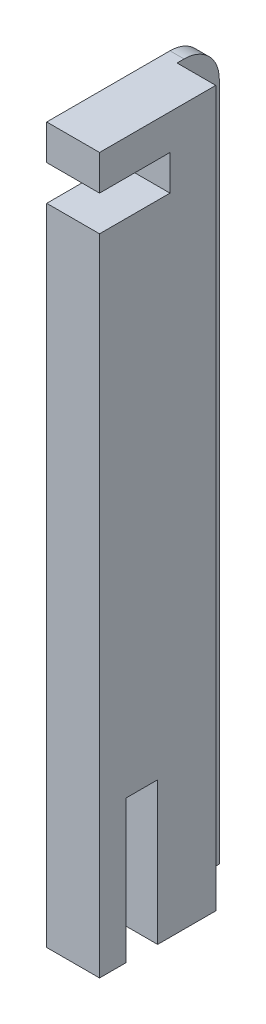
from build123d import *

# Parameters (mm, degrees)
EXTRUDE_1_DEPTH        = 26
EXTRUDE_2_DEPTH        = 19
FILLET_1_R             = 10
SKETCH_5_W             = 161
SKETCH_5_H             = 6
CUT_EXTRUDE_1_DEPTH    = 52
SKETCH_1_5_W           = 11
SKETCH_1_5_H           = 340
EXTRUDE_4_DEPTH        = 7
SKETCH_6_W             = 1.9
SKETCH_6_H             = 2
SKETCH_6_W_2           = 6.6
EXTRUDE_5_DEPTH        = 28
SKETCH_6_3_W           = 6.6
SKETCH_6_3_H           = 2
CUT_EXTRUDE_2_DEPTH    = 5
FILLET_2_R             = 20
SKETCH_6_4_W           = 15
SKETCH_6_4_H           = 10
SKETCH_6_4_H_2         = 9
EXTRUDE_6_DEPTH        = 30
SKETCH_6_5_W           = 15
SKETCH_6_5_H           = 9
EXTRUDE_7_DEPTH        = 28
EXTRUDE_8_DEPTH        = 15
FILLET_3_R             = 20
FILLET_3_OF_MIRROR_2_R = 20
FILLET_4_R             = 20
SKETCH_11_W            = 20
SKETCH_11_H            = 20
CUT_EXTRUDE_3_DEPTH    = 617
SKETCH_10_W            = 20
SKETCH_10_H            = 10
CUT_EXTRUDE_4_DEPTH    = 617
CUT_EXTRUDE_START      = -37
SKETCH_12_W            = 8
SKETCH_12_H            = 20
SKETCH_12_W_2          = 0.5
CUT_EXTRUDE_5_DEPTH    = 37


with BuildPart() as part:
    # 스케치1 → 보스-돌출1 (new body)
    with BuildSketch(Plane.XY):
        Polygon((-168, 0), (168, 0), (183, 0), (183, -340), (168, -340), (168, -20), (-168, -20), (-168, -340), (-183, -340), (-183, 0), align=None)
    extrude(amount=EXTRUDE_1_DEPTH)

    # 스케치1<4> → 보스-돌출2 (add)
    with BuildSketch(Plane.XY):
        Polygon((172, 0), (168, 0), (168, -20), (168, -340), (172, -340), align=None)
        Polygon((-168, -20), (-168, 0), (-172, 0), (-172, -340), (-168, -340), align=None)
    extrude(amount=-EXTRUDE_2_DEPTH)

    # 필렛1
    fillet_1_edges = [part.edges().sort_by_distance(p)[0] for p in [
        (170, 0, -19),
        (170, -340, -19),
        (-170, -340, -19),
        (-170, 0, -19),
    ]]
    fillet(fillet_1_edges, radius=FILLET_1_R)

    # 스케치5 → 컷-돌출1 (cut)
    with BuildSketch(Plane(origin=(0, 0, 0), x_dir=(1, 0, 0), z_dir=(0, 1, 0))):
        with Locations((-87.5, -3)):
            Rectangle(SKETCH_5_W, SKETCH_5_H)
        with Locations((87.5, -3)):
            Rectangle(SKETCH_5_W, SKETCH_5_H)
    extrude(amount=-CUT_EXTRUDE_1_DEPTH, mode=Mode.SUBTRACT)

    # 스케치1<5> → 보스-돌출4 (add)
    with BuildSketch(Plane.XY):
        with Locations((177.5, -170)):
            Rectangle(SKETCH_1_5_W, SKETCH_1_5_H)
        with Locations((-177.5, -170)):
            Rectangle(SKETCH_1_5_W, SKETCH_1_5_H)
    extrude(amount=-EXTRUDE_4_DEPTH)

    # 스케치6 → 보스-돌출5 (add)
    with BuildSketch(Plane.XZ.offset(340)):
        with Locations((-182.05, -6)):
            Rectangle(SKETCH_6_W, SKETCH_6_H)
        with Locations((-177.8, -6)):
            Rectangle(SKETCH_6_W_2, SKETCH_6_H)
        Polygon((-174.5, -7), (-172, -7), (-168, -7), (-168, -5), (-174.5, -5), align=None)
    extrude_5 = extrude(amount=EXTRUDE_5_DEPTH)

    # 스케치6<3> → 컷-돌출2 (cut)
    with BuildSketch(Plane.XZ.offset(340)):
        with Locations((-177.8, -6)):
            Rectangle(SKETCH_6_3_W, SKETCH_6_3_H)
    cut_extrude_2 = extrude(amount=CUT_EXTRUDE_2_DEPTH, mode=Mode.SUBTRACT)

    # 필렛2
    # the kernel refuses this fillet: 20 mm, written as the material it adds along each edge
    with BuildSketch(Plane(origin=(-172, -340, -7), x_dir=(0, -1, 0), z_dir=(1, 0, 0))) as fillet_2_piece_1:
        with BuildLine():
            CenterArc((14, 20), FILLET_2_R, 216.869897646, 53.130102354)
            Line((-2, 8), (-3.6, 6.8))
            ThreePointArc((-3.6, 6.8), (-2, 2), (-2, 0))
            Line((-2, 0), (0, -2))
            Line((0, -2), (14, -2))
            Line((14, -2), (14, 0))
        make_face()
    extrude(amount=4)

    # 스케치6<4> → 보스-돌출6 (add)
    with BuildSketch(Plane.XZ.offset(340)):
        with Locations((-175.5, 31)):
            Rectangle(SKETCH_6_4_W, SKETCH_6_4_H)
        with Locations((-175.5, 40.5)):
            Rectangle(SKETCH_6_4_W, SKETCH_6_4_H_2)
    extrude_6 = extrude(amount=-EXTRUDE_6_DEPTH)

    # 스케치6<5> → 보스-돌출7 (add)
    with BuildSketch(Plane.XZ.offset(340)):
        with Locations((-175.5, 40.5)):
            Rectangle(SKETCH_6_5_W, SKETCH_6_5_H)
    extrude_7 = extrude(amount=EXTRUDE_7_DEPTH)

    # 스케치9 → 보스-돌출8 (add)
    with BuildSketch(Plane.ZY.offset(183)):
        Polygon((26, -310), (45, -310), (26, -270), align=None)
    extrude_8 = extrude(amount=-EXTRUDE_8_DEPTH)

    # 필렛3
    fillet_3_edges = [part.edges().sort_by_distance(p)[0] for p in [
        (-175.5, -310, 45),
        (-175.5, -270, 26),
    ]]
    fillet(fillet_3_edges, radius=FILLET_3_R)

    # 대칭 복사2: 보스-돌출5, 컷-돌출2, 보스-돌출6, 보스-돌출7, 보스-돌출8 across plane
    add(extrude_5.mirror(Plane(origin=(0, 0, 0), x_dir=(0, 0, 1), z_dir=(1, 0, 0))))
    add(cut_extrude_2.mirror(Plane(origin=(0, 0, 0), x_dir=(0, 0, 1), z_dir=(1, 0, 0))), mode=Mode.SUBTRACT)
    add(extrude_6.mirror(Plane(origin=(0, 0, 0), x_dir=(0, 0, 1), z_dir=(1, 0, 0))))
    add(extrude_7.mirror(Plane(origin=(0, 0, 0), x_dir=(0, 0, 1), z_dir=(1, 0, 0))))
    add(extrude_8.mirror(Plane(origin=(0, 0, 0), x_dir=(0, 0, 1), z_dir=(1, 0, 0))))

    # 필렛3 of 대칭 복사2
    fillet_3_of_mirror_2_edges = [part.edges().sort_by_distance(p)[0] for p in [
        (175.5, -310, 45),
        (175.5, -270, 26),
    ]]
    fillet(fillet_3_of_mirror_2_edges, radius=FILLET_3_OF_MIRROR_2_R)

    # 필렛4
    # the kernel refuses this fillet: 20 mm, written as the material it adds along each edge
    with BuildSketch(Plane(origin=(172, -340, -7), x_dir=(0, 0.24253562503633938, -0.9701425001453302), z_dir=(-1, 0, 0))) as fillet_4_piece_1:
        with BuildLine():
            CenterArc((16.007351252, 18.432707503), FILLET_4_R, 194.036243468, 53.130102354)
            Line((-3.395498751, 13.581995002), (-5.335783751, 13.096923752))
            Line((-5.335783751, 13.096923752), (-1.940285, -0.48507125))
            Line((-1.940285, -0.48507125), (0.48507125, -1.940285))
            ThreePointArc((0.48507125, -1.940285), (2.42535625, -1.45521375), (7.470097251, -1.84327075))
            Line((7.470097251, -1.84327075), (8.246211251, 0))
        make_face()
    extrude(amount=4)

    # 스케치11 → 컷-돌출3 (cut)
    with BuildSketch(Plane.ZY.offset(-168)):
        with BuildLine():
            ThreePointArc((45, -314.508610159), (44.510394688, -310.110371974), (43.065550087, -305.927473868))
            Line((43.065550087, -305.927473868), (27.934449913, -274.072526132))
            ThreePointArc((27.934449913, -274.072526132), (26.489605312, -269.889628026), (26, -265.491389841))
            Line((26, -265.491389841), (26, -20))
            Line((26, -20), (6, -20))
            Line((6, -20), (6, 0))
            Line((6, 0), (-7, 0))
            Line((-7, 0), (-7, -354))
            Line((-7, -354), (-7, -368))
            Line((-7, -368), (-5, -368))
            Line((-5, -368), (-5, -340))
            Line((-5, -340), (36, -340))
            Line((36, -340), (36, -368))
            Line((36, -368), (45, -368))
            Line((45, -368), (45, -314.508610159))
        make_face()
        with Locations((16, -10)):
            Rectangle(SKETCH_11_W, SKETCH_11_H)
        with BuildLine():
            Line((-7, -354), (-7, 0))
            Line((-7, 0), (-9, 0))
            ThreePointArc((-9, 0), (-16.071067812, -2.928932188), (-19, -10))
            Line((-19, -10), (-19, -330))
            ThreePointArc((-19, -330), (-17.94427191, -334.472135955), (-15, -338))
            ThreePointArc((-15, -338), (-9.11145618, -345.05572809), (-7, -354))
        make_face()
    extrude(amount=CUT_EXTRUDE_3_DEPTH, mode=Mode.SUBTRACT)

    # 스케치10 → 컷-돌출4 (cut)
    with BuildSketch(Plane(origin=(183, 0, 0), x_dir=(0, 0, -1), z_dir=(1, 0, 0))):
        with Locations((-16, -15)):
            Rectangle(SKETCH_10_W, SKETCH_10_H)
    extrude(amount=-CUT_EXTRUDE_4_DEPTH, mode=Mode.SUBTRACT)

    # 스케치12 → 컷-돌출5 (cut)
    with BuildSketch(Plane.ZY.offset(-168).offset(CUT_EXTRUDE_START)):
        with Locations((14, -173)):
            Rectangle(SKETCH_12_W, SKETCH_12_H)
        with BuildLine():
            Line((18.5, -203), (18, -203))
            Line((18, -203), (18, -183))
            Line((18, -183), (10, -183))
            Line((10, -183), (10, -203))
            Line((10, -203), (9.5, -203))
            Line((9.5, -203), (-7, -203))
            Line((-7, -203), (-7, -354))
            Line((-7, -354), (-7, -368))
            Line((-7, -368), (-5, -368))
            Line((-5, -368), (-5, -340))
            Line((-5, -340), (36, -340))
            Line((36, -340), (36, -368))
            Line((36, -368), (45, -368))
            Line((45, -368), (45, -314.508610159))
            ThreePointArc((45, -314.508610159), (44.510394688, -310.110371974), (43.065550087, -305.927473868))
            Line((43.065550087, -305.927473868), (27.934449913, -274.072526132))
            ThreePointArc((27.934449913, -274.072526132), (26.489605312, -269.889628026), (26, -265.491389841))
            Line((26, -265.491389841), (26, -203))
            Line((26, -203), (18.5, -203))
        make_face()
        Polygon((18, -163), (18, -183), (18.5, -183), (18.5, -162.5), (9.5, -162.5), (9.5, -183), (10, -183), (10, -163), align=None)
        with Locations((18.25, -193)):
            Rectangle(SKETCH_12_W_2, SKETCH_12_H)
        with Locations((9.75, -193)):
            Rectangle(SKETCH_12_W_2, SKETCH_12_H)
        with BuildLine():
            Line((-7, -354), (-7, -203))
            Line((-7, -203), (-19, -203))
            Line((-19, -203), (-19, -330))
            ThreePointArc((-19, -330), (-17.94427191, -334.472135955), (-15, -338))
            ThreePointArc((-15, -338), (-9.11145618, -345.05572809), (-7, -354))
        make_face()
    extrude(amount=CUT_EXTRUDE_5_DEPTH, mode=Mode.SUBTRACT)


solid = part.part
